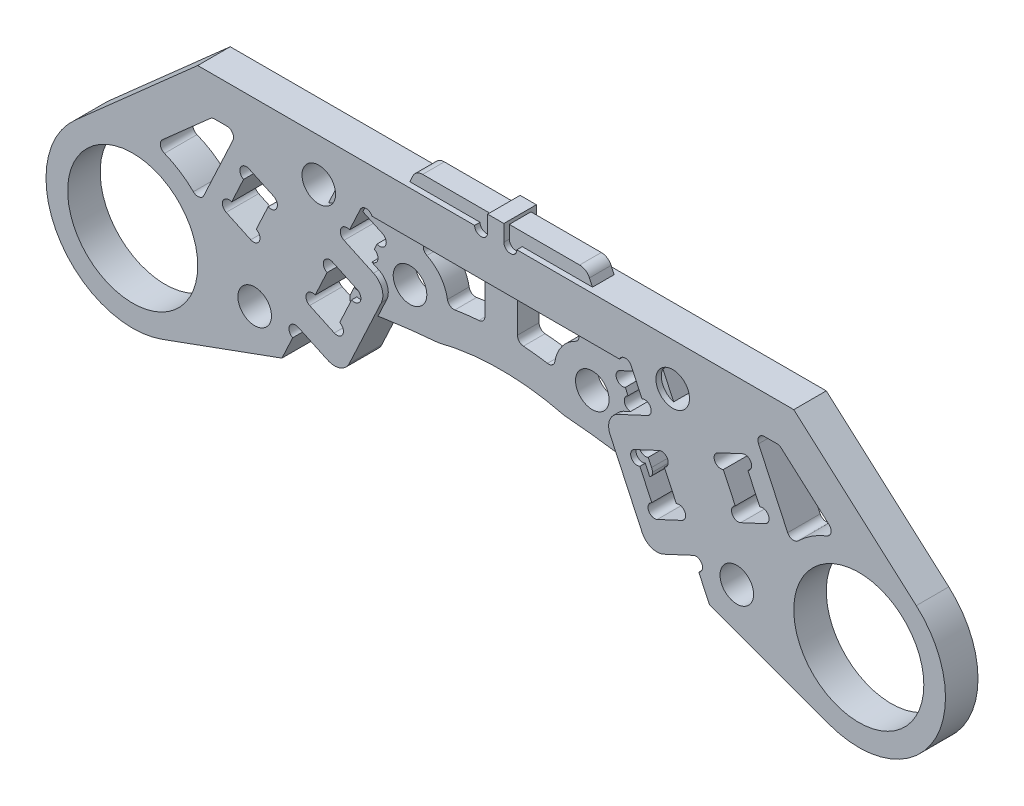
from build123d import *

# Parameters (mm, degrees)
F_3MM_START         = -1.5
F_3MM_OUTLINE_R     = 6
F_3MM_OUTLINE_R_2   = 1.55
F_3MM_DEPTH         = 3
EXTRUDE_1_DEPTH     = 1
EXTRUDE_2_DEPTH     = 2
SKETCH_5_R          = 0.6
CUT_EXTRUDE_1_DEPTH = 46.108203245
FILLET_1_R          = 1
SKETCH_9_R          = 1.55
CUT_EXTRUDE_3_DEPTH = 46.108203245
CUT_EXTRUDE_4_DEPTH = 46.108203245
FILLET_3_R          = 1
EXTRUDE_3_DEPTH     = 2
FILLET_5_R          = 1
SKETCH_12_W         = 3
SKETCH_12_H         = 8.288309019
EXTRUDE_4_DEPTH     = 2
FILLET_4_R          = 0.6
SKETCH_13_R         = 23.5
CUT_EXTRUDE_5_DEPTH = 46.108203245
EXTRUDE_5_DEPTH     = 2
FILLET_6_R          = 0.6
SKETCH_15_R         = 73
CUT_EXTRUDE_6_DEPTH = 46.108203245
FILLET_7_R          = 0.5


# Read off the part's stored shape, not the designer's step: 弹轮后支撑-轨道连接板_3mm
with BuildPart() as part:
    # 弹轮后支撑-轨道连接板_3mm outline → 弹轮后支撑-轨道连接板_3mm (new body)
    with BuildSketch(Plane.XY.offset(F_3MM_START)):
        with BuildLine():
            Line((-1.95, 16), (-27.5, 16))
            Line((-27.5, 16), (-38.803964436, 5.988986664))
            ThreePointArc((-38.803964436, 5.988986664), (-40.374225454, -4.092068476), (-30.763838853, -7.517540966))
            Line((-30.763838853, -7.517540966), (-19.728184266, -3.500891181))
            Line((-19.728184266, -3.500891181), (-18.734325356, -1.36955387))
            ThreePointArc((-18.734325356, -1.36955387), (-19.024539071, -0.572198241), (-18.227183442, -0.281984526))
            Line((-18.227183442, -0.281984526), (-15.508260081, -1.549839311))
            ThreePointArc((-15.508260081, -1.549839311), (-14.361302473, -1.599916561), (-13.514871007, -0.824305023))
            Line((-13.514871007, -0.824305023), (-10.556543175, 5.519849486))
            ThreePointArc((-10.556543175, 5.519849486), (-10.506465925, 6.666807094), (-11.282077463, 7.51323856))
            Line((-11.282077463, 7.51323856), (-14.001000824, 8.781093345))
            ThreePointArc((-14.001000824, 8.781093345), (-14.291214539, 9.578448974), (-13.49385891, 9.868662689))
            Line((-13.49385891, 9.868662689), (-12.5, 12))
            ThreePointArc((-12.5, 12), (-11.956215328, 12.346429043), (-11.412430656, 12))
            Line((-11.412430656, 12), (11.412430656, 12))
            ThreePointArc((11.412430656, 12), (11.956215328, 12.346429043), (12.5, 12))
            Line((12.5, 12), (13.49385891, 9.868662689))
            ThreePointArc((13.49385891, 9.868662689), (14.291214539, 9.578448974), (14.001000824, 8.781093345))
            Line((14.001000824, 8.781093345), (11.282077463, 7.51323856))
            ThreePointArc((11.282077463, 7.51323856), (10.506465925, 6.666807094), (10.556543175, 5.519849486))
            Line((10.556543175, 5.519849486), (13.514871007, -0.824305023))
            ThreePointArc((13.514871007, -0.824305023), (14.361302473, -1.599916561), (15.508260081, -1.549839311))
            Line((15.508260081, -1.549839311), (18.227183442, -0.281984526))
            ThreePointArc((18.227183442, -0.281984526), (19.024539071, -0.572198241), (18.734325356, -1.36955387))
            Line((18.734325356, -1.36955387), (19.728184266, -3.500891181))
            Line((19.728184266, -3.500891181), (30.763838853, -7.517540966))
            ThreePointArc((30.763838853, -7.517540966), (40.374225454, -4.092068476), (38.803964436, 5.988986664))
            Line((38.803964436, 5.988986664), (27.5, 16))
            Line((27.5, 16), (1.95, 16))
            ThreePointArc((1.95, 16), (1.35, 15.4), (0.75, 16))
            Line((0.75, 16), (0.75, 17.5))
            Line((0.75, 17.5), (-0.75, 17.5))
            Line((-0.75, 17.5), (-0.75, 16))
            ThreePointArc((-0.75, 16), (-1.35, 15.4), (-1.95, 16))
        make_face()
        with Locations((-33.5, 0)):
            Circle(F_3MM_OUTLINE_R, mode=Mode.SUBTRACT)
        with Locations((-22.24449722, -0.615436184)):
            Circle(F_3MM_OUTLINE_R_2, mode=Mode.SUBTRACT)
        with BuildLine():
            Line((-16.663495873, 3.071354286), (-15.564688393, 5.427754533))
            ThreePointArc((-15.564688393, 5.427754533), (-15.854902108, 6.225110162), (-15.057546479, 6.515323877))
            Line((-15.057546479, 6.515323877), (-12.791777011, 5.458778223))
            ThreePointArc((-12.791777011, 5.458778223), (-12.501563296, 4.661422594), (-13.298918925, 4.371208878))
            Line((-13.298918925, 4.371208878), (-14.397726406, 2.014808632))
            ThreePointArc((-14.397726406, 2.014808632), (-14.10751269, 1.217453003), (-14.90486832, 0.927239288))
            Line((-14.90486832, 0.927239288), (-17.170637787, 1.983784942))
            ThreePointArc((-17.170637787, 1.983784942), (-17.460851502, 2.781140571), (-16.663495873, 3.071354286))
        make_face(mode=Mode.SUBTRACT)
        with BuildLine():
            Line((15.564688393, 5.427754533), (16.663495873, 3.071354286))
            ThreePointArc((16.663495873, 3.071354286), (17.460851502, 2.781140571), (17.170637787, 1.983784942))
            Line((17.170637787, 1.983784942), (14.90486832, 0.927239288))
            ThreePointArc((14.90486832, 0.927239288), (14.10751269, 1.217453003), (14.397726406, 2.014808632))
            Line((14.397726406, 2.014808632), (13.298918925, 4.371208878))
            ThreePointArc((13.298918925, 4.371208878), (12.501563296, 4.661422594), (12.791777011, 5.458778223))
            Line((12.791777011, 5.458778223), (15.057546479, 6.515323877))
            ThreePointArc((15.057546479, 6.515323877), (15.854902108, 6.225110162), (15.564688393, 5.427754533))
        make_face(mode=Mode.SUBTRACT)
        with Locations((22.24449722, -0.615436184)):
            Circle(F_3MM_OUTLINE_R_2, mode=Mode.SUBTRACT)
        with Locations((33.5, 0)):
            Circle(F_3MM_OUTLINE_R, mode=Mode.SUBTRACT)
        with BuildLine():
            ThreePointArc((-22.101342595, 5.607063857), (-21.81112888, 4.809708228), (-22.608484509, 4.519494512))
            Line((-22.608484509, 4.519494512), (-24.874253977, 5.576040167))
            ThreePointArc((-24.874253977, 5.576040167), (-25.164467692, 6.373395796), (-24.367112063, 6.663609511))
            Line((-24.367112063, 6.663609511), (-23.268304582, 9.020009758))
            ThreePointArc((-23.268304582, 9.020009758), (-23.558518298, 9.817365387), (-22.761162668, 10.107579102))
            Line((-22.761162668, 10.107579102), (-20.495393201, 9.051033448))
            ThreePointArc((-20.495393201, 9.051033448), (-20.205179486, 8.253677819), (-21.002535115, 7.963464103))
            Line((-21.002535115, 7.963464103), (-22.101342595, 5.607063857))
        make_face(mode=Mode.SUBTRACT)
        with BuildLine():
            Line((-25.945473235, 12.5), (-24.794125666, 12.5))
            ThreePointArc((-24.794125666, 12.5), (-24.288090799, 12.222379765), (-24.250340994, 11.646429043))
            Line((-24.250340994, 11.646429043), (-26.93573384, 5.887585502))
            ThreePointArc((-26.93573384, 5.887585502), (-27.372399442, 5.550795971), (-27.899552104, 5.712703682))
            ThreePointArc((-27.899552104, 5.712703682), (-29.146691402, 6.711833152), (-30.567528811, 7.443158787))
            ThreePointArc((-30.567528811, 7.443158787), (-30.938455214, 7.897076945), (-30.745390805, 8.450569696))
            Line((-30.745390805, 8.450569696), (-26.343270567, 12.349174))
            ThreePointArc((-26.343270567, 12.349174), (-26.158188537, 12.461027807), (-25.945473235, 12.5))
        make_face(mode=Mode.SUBTRACT)
        with Locations((-16.327841555, 12.072872835)):
            Circle(F_3MM_OUTLINE_R_2, mode=Mode.SUBTRACT)
        with BuildLine():
            ThreePointArc((22.608484509, 4.519494512), (21.81112888, 4.809708228), (22.101342595, 5.607063857))
            Line((22.101342595, 5.607063857), (21.002535115, 7.963464103))
            ThreePointArc((21.002535115, 7.963464103), (20.205179486, 8.253677819), (20.495393201, 9.051033448))
            Line((20.495393201, 9.051033448), (22.761162668, 10.107579102))
            ThreePointArc((22.761162668, 10.107579102), (23.558518298, 9.817365387), (23.268304582, 9.020009758))
            Line((23.268304582, 9.020009758), (24.367112063, 6.663609511))
            ThreePointArc((24.367112063, 6.663609511), (25.164467692, 6.373395796), (24.874253977, 5.576040167))
            Line((24.874253977, 5.576040167), (22.608484509, 4.519494512))
        make_face(mode=Mode.SUBTRACT)
        with BuildLine():
            Line((26.343270567, 12.349174), (30.745390805, 8.450569696))
            ThreePointArc((30.745390805, 8.450569696), (30.938455214, 7.897076945), (30.567528811, 7.443158787))
            ThreePointArc((30.567528811, 7.443158787), (29.146691402, 6.711833152), (27.899552104, 5.712703682))
            ThreePointArc((27.899552104, 5.712703682), (27.372399442, 5.550795971), (26.93573384, 5.887585502))
            Line((26.93573384, 5.887585502), (24.250340994, 11.646429043))
            ThreePointArc((24.250340994, 11.646429043), (24.288090799, 12.222379765), (24.794125666, 12.5))
            Line((24.794125666, 12.5), (25.945473235, 12.5))
            ThreePointArc((25.945473235, 12.5), (26.158188537, 12.461027807), (26.343270567, 12.349174))
        make_face(mode=Mode.SUBTRACT)
        with Locations((16.327841555, 12.072872835)):
            Circle(F_3MM_OUTLINE_R_2, mode=Mode.SUBTRACT)
    extrude(amount=F_3MM_DEPTH)


with BuildPart() as body_2:
    # 草图3 → 凸台-拉伸1 (new, symmetric)
    with BuildSketch(Plane.XY):
        Polygon((-8.624608023, 15.578401748), (-14.541263688, 2.890092729), (14.541263688, 2.890092729), (8.624608023, 15.578401748), align=None)
    extrude(amount=EXTRUDE_1_DEPTH, both=True)

    # 草图4 → 凸台-拉伸2 (add)
    with BuildSketch(Plane.XY.offset(1)):
        Polygon((-10.103771939, 12.406324493), (-10.949008463, 10.593708919), (-13.21477793, 11.650254573), (-14.482632716, 8.931331212), (-12.216863248, 7.874785558), (-13.062099772, 6.062169984), (-17.140484813, 7.963952162), (-14.182156981, 14.308106671), align=None)
        Polygon((17.140484813, 7.963952162), (14.182156981, 14.308106671), (10.103771939, 12.406324493), (10.949008463, 10.593708919), (13.21477793, 11.650254573), (14.482632716, 8.931331212), (12.216863248, 7.874785558), (13.062099772, 6.062169984), align=None)
    extrude(amount=-EXTRUDE_2_DEPTH)

    # 草图5 → 切除-拉伸1 (cut, through all)
    with BuildSketch(Plane.XY.offset(1)):
        with Locations((-11.20257942, 10.049924247)):
            Circle(SKETCH_5_R)
        with Locations((-11.963292291, 8.41857023)):
            Circle(SKETCH_5_R)
        with Locations((-14.229061759, 9.475115884)):
            Circle(SKETCH_5_R)
        with Locations((-13.468348887, 11.106469901)):
            Circle(SKETCH_5_R)
        with Locations((-9.850200982, 12.950109165)):
            Circle(SKETCH_5_R)
        with Locations((-13.315670729, 5.518385311)):
            Circle(SKETCH_5_R)
        with Locations((13.315670729, 5.518385311)):
            Circle(SKETCH_5_R)
        with Locations((9.850200982, 12.950109165)):
            Circle(SKETCH_5_R)
        with Locations((13.468348887, 11.106469901)):
            Circle(SKETCH_5_R)
        with Locations((14.229061759, 9.475115884)):
            Circle(SKETCH_5_R)
        with Locations((11.963292291, 8.41857023)):
            Circle(SKETCH_5_R)
        with Locations((11.20257942, 10.049924247)):
            Circle(SKETCH_5_R)
    extrude(amount=-CUT_EXTRUDE_1_DEPTH, mode=Mode.SUBTRACT)

    # 圆角1
    fillet_1_edges = [body_2.edges().sort_by_distance(p)[0] for p in [
        (-14.182156981, 14.308106671, 0),
        (-17.140484813, 7.963952162, 0),
        (17.140484813, 7.963952162, 0),
        (14.182156981, 14.308106671, 0),
    ]]
    fillet(fillet_1_edges, radius=FILLET_1_R)

    # 草图9 → 切除-拉伸3 (cut, through all)
    with BuildSketch(Plane.XY.offset(1)):
        with Locations((-8.410858601, 7.755083322)):
            Circle(SKETCH_9_R)
        with Locations((8.410858601, 7.755083322)):
            Circle(SKETCH_9_R)
    extrude(amount=-CUT_EXTRUDE_3_DEPTH, mode=Mode.SUBTRACT)

    # 草图7 → 切除-拉伸4 (cut, through all)
    with BuildSketch(Plane.XY.offset(1)):
        with BuildLine():
            Line((-5.967304988, 14.178401748), (-7.400019891, 11.105934722))
            ThreePointArc((-7.400019891, 11.105934722), (-5.132663077, 8.981229361), (-5.449134426, 5.890092729))
            Line((-5.449134426, 5.890092729), (5.449134426, 5.890092729))
            ThreePointArc((5.449134426, 5.890092729), (5.132663077, 8.981229361), (7.400019891, 11.105934722))
            Line((7.400019891, 11.105934722), (5.967304988, 14.178401748))
            Line((5.967304988, 14.178401748), (-5.967304988, 14.178401748))
        make_face()
    extrude(amount=-CUT_EXTRUDE_4_DEPTH, mode=Mode.SUBTRACT)

    # 圆角3
    fillet_3_edges = [body_2.edges().sort_by_distance(p)[0] for p in [
        (8.624608023, 15.578401748, 0),
        (14.541263688, 2.890092729, 0),
        (-14.541263688, 2.890092729, 0),
        (-8.624608023, 15.578401748, 0),
    ]]
    fillet(fillet_3_edges, radius=FILLET_3_R)

    # 草图10 → 凸台-拉伸3 (add)
    with BuildSketch(Plane.XY.offset(1)):
        Polygon((-8.893845549, 15.001020009), (-7.87851577, 17.178401748), (7.87851577, 17.178401748), (8.893845549, 15.001020009), align=None)
    extrude(amount=-EXTRUDE_3_DEPTH)

    # 圆角5
    fillet_5_edges = [body_2.edges().sort_by_distance(p)[0] for p in [
        (-7.87851577, 17.178401748, 0),
        (7.87851577, 17.178401748, 0),
    ]]
    fillet(fillet_5_edges, radius=FILLET_5_R)

    # 草图12 → 凸台-拉伸4 (add)
    with BuildSketch(Plane.XY.offset(1)):
        with Locations((0, 10.034247239)):
            Rectangle(SKETCH_12_W, SKETCH_12_H)
    extrude(amount=-EXTRUDE_4_DEPTH)

    # 圆角4
    fillet_4_edges = [body_2.edges().sort_by_distance(p)[0] for p in [
        (-5.967304988, 14.178401748, 0),
        (5.967304988, 14.178401748, 0),
        (7.400019891, 11.105934722, 0),
        (5.449134426, 5.890092729, 0),
        (-5.449134426, 5.890092729, 0),
        (-7.400019891, 11.105934722, 0),
        (-1.5, 14.178401748, 0),
        (1.5, 14.178401748, 0),
        (1.5, 5.890092729, 0),
        (-1.5, 5.890092729, 0),
    ]]
    fillet(fillet_4_edges, radius=FILLET_4_R)

    # 草图13 → 切除-拉伸5 (cut, through all)
    with BuildSketch(Plane(origin=(0, 0, -1), x_dir=(-1, 0, 0), z_dir=(0, 0, -1))):
        with Locations((0, -18.321598252)):
            Circle(SKETCH_13_R)
    extrude(amount=-CUT_EXTRUDE_5_DEPTH, mode=Mode.SUBTRACT)

    # 草图14 → 凸台-拉伸5 (add)
    with BuildSketch(Plane(origin=(0, 0, -1), x_dir=(-1, 0, 0), z_dir=(0, 0, -1))):
        with BuildLine():
            Line((4.510884396, 5.890092729), (2.1, 5.890092729))
            ThreePointArc((2.1, 5.890092729), (1.675735931, 6.06582866), (1.5, 6.490092729))
            Line((1.5, 6.490092729), (1.5, 8.135914858))
            ThreePointArc((1.5, 8.135914858), (3.212279579, 7.982988038), (4.91104088, 7.719363279))
            ThreePointArc((4.91104088, 7.719363279), (4.95664508, 7.190805951), (5.081612328, 6.675213304))
            ThreePointArc((5.081612328, 6.675213304), (4.996205086, 6.137298416), (4.510884396, 5.890092729))
        make_face()
        with BuildLine():
            Line((-1.5, 6.490092729), (-1.5, 8.135914858))
            ThreePointArc((-1.5, 8.135914858), (-3.212279579, 7.982988038), (-4.91104088, 7.719363279))
            ThreePointArc((-4.91104088, 7.719363279), (-4.95664508, 7.190805951), (-5.081612328, 6.675213304))
            ThreePointArc((-5.081612328, 6.675213304), (-4.996205086, 6.137298416), (-4.510884396, 5.890092729))
            Line((-4.510884396, 5.890092729), (-2.1, 5.890092729))
            ThreePointArc((-2.1, 5.890092729), (-1.675735931, 6.06582866), (-1.5, 6.490092729))
        make_face()
    extrude(amount=-EXTRUDE_5_DEPTH)

    # 圆角6
    fillet_6_edges = [body_2.edges().sort_by_distance(p)[0] for p in [
        (-1.5, 8.135914858, 0),
        (-4.91104088, 7.719363279, 0),
        (4.91104088, 7.719363279, 0),
        (1.5, 8.135914858, 0),
    ]]
    fillet(fillet_6_edges, radius=FILLET_6_R)

    # 草图15 → 切除-拉伸6 (cut, through all)
    with BuildSketch(Plane(origin=(0, 0, -1), x_dir=(-1, 0, 0), z_dir=(0, 0, -1))):
        with Locations((0, -68.321598252)):
            Circle(SKETCH_15_R)
    extrude(amount=-CUT_EXTRUDE_6_DEPTH, mode=Mode.SUBTRACT)

    # 圆角7
    fillet_7_edges = [body_2.edges().sort_by_distance(p)[0] for p in [
        (-13.818618866, 3.358564782, 0),
        (13.818618866, 3.358564782, 0),
    ]]
    fillet(fillet_7_edges, radius=FILLET_7_R)


solid = Compound([part.part, body_2.part])
